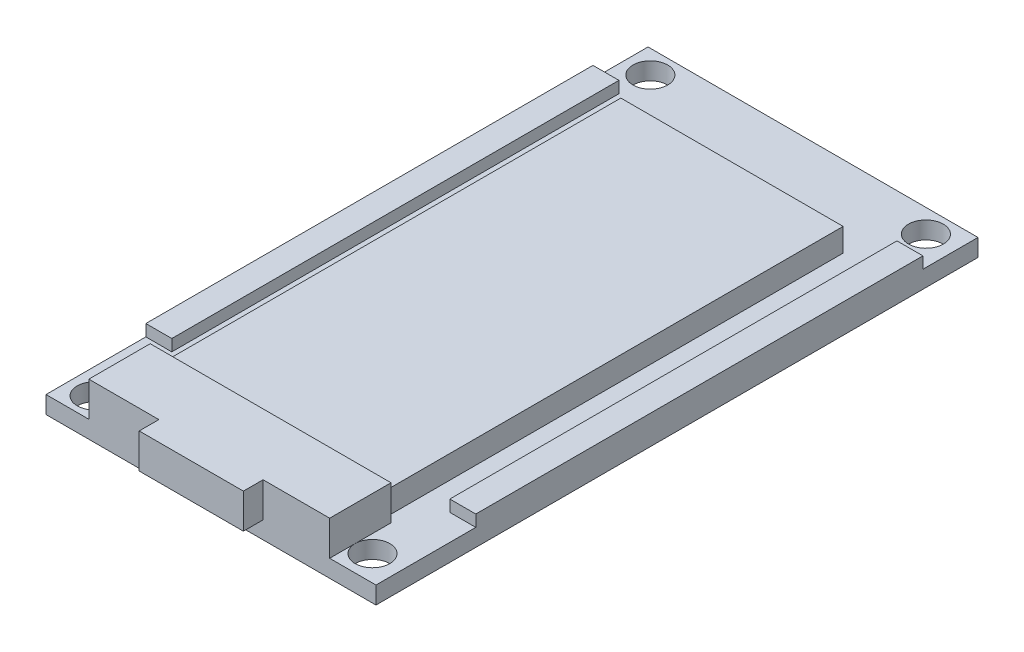
from build123d import *

# Parameters (mm, degrees)
SKETCH_2_W            = 28.5
SKETCH_2_H            = 52
SKETCH_2_R            = 1.5
EXTRUDE_1_DEPTH       = 1.5
EXTRUDE_START         = 4.65
EXTRUDE_2_DEPTH       = 19.2
EXTRUDE_2_2_OUTLINE_W = 1
EXTRUDE_2_2_OUTLINE_H = 38.620640838
EXTRUDE_2_2_DEPTH     = 2.24290402
EXTRUDE_START_2       = 26.25709598
EXTRUDE_2_3_OUTLINE_W = 1
EXTRUDE_2_3_OUTLINE_H = 38.620640838
EXTRUDE_2_3_DEPTH     = 2.24290402
EXTRUDE_START_3       = 9.75
EXTRUDE_2_4_OUTLINE_W = 3
EXTRUDE_2_4_OUTLINE_H = 1.7
EXTRUDE_2_4_DEPTH     = 9
EXTRUDE_START_4       = 3.7
EXTRUDE_2_5_OUTLINE_W = 3
EXTRUDE_2_5_OUTLINE_H = 5.3
EXTRUDE_2_5_DEPTH     = 20.8


# Read off the part's stored shape, not the designer's step: Бобышка-Вытянуть2
with BuildPart() as part:
    # Эскиз2 → Бобышка-Вытянуть1 (new body)
    with BuildSketch(Plane(origin=(0, 0, 0), x_dir=(1, 0, 0), z_dir=(0, 1, 0))):
        with Locations((14.25, -26)):
            Rectangle(SKETCH_2_W, SKETCH_2_H)
        with Locations(Location((2.2, -2, 0), (0, 0, 270))):
            Circle(SKETCH_2_R, mode=Mode.SUBTRACT)
        with Locations(Location((26, -2, 0), (0, 0, 270))):
            Circle(SKETCH_2_R, mode=Mode.SUBTRACT)
        with Locations(Location((2.2, -50, 0), (0, 0, 90))):
            Circle(SKETCH_2_R, mode=Mode.SUBTRACT)
        with Locations(Location((26, -49.8, 0), (0, 0, 270))):
            Circle(SKETCH_2_R, mode=Mode.SUBTRACT)
    extrude(amount=EXTRUDE_1_DEPTH)

    # Бобышка-Вытянуть2 outline → Бобышка-Вытянуть2 (add)
    with BuildSketch(Plane.YZ.offset(EXTRUDE_START)):
        Polygon((4.5, 52), (1.5, 52), (1.5, 7), (3.5, 7), (3.5, 46.7), (4.5, 46.7), align=None)
    extrude(amount=EXTRUDE_2_DEPTH)

    # Extrude 2 2 outline → Extrude 2 2 (add)
    with BuildSketch(Plane.YZ):
        with Locations((2, 24.067488006)):
            Rectangle(EXTRUDE_2_2_OUTLINE_W, EXTRUDE_2_2_OUTLINE_H)
    extrude(amount=EXTRUDE_2_2_DEPTH)

    # Extrude 2 3 outline → Extrude 2 3 (add)
    with BuildSketch(Plane.YZ.offset(EXTRUDE_START_2)):
        with Locations((2, 24.067488006)):
            Rectangle(EXTRUDE_2_3_OUTLINE_W, EXTRUDE_2_3_OUTLINE_H)
    extrude(amount=EXTRUDE_2_3_DEPTH)

    # Extrude 2 4 outline → Extrude 2 4 (add)
    with BuildSketch(Plane.YZ.offset(EXTRUDE_START_3)):
        with Locations((3, 52.85)):
            Rectangle(EXTRUDE_2_4_OUTLINE_W, EXTRUDE_2_4_OUTLINE_H)
    extrude(amount=EXTRUDE_2_4_DEPTH)

    # Extrude 2 5 outline → Extrude 2 5 (add)
    with BuildSketch(Plane.YZ.offset(EXTRUDE_START_4)):
        with Locations((3, 49.35)):
            Rectangle(EXTRUDE_2_5_OUTLINE_W, EXTRUDE_2_5_OUTLINE_H)
    extrude(amount=EXTRUDE_2_5_DEPTH)


solid = part.part
